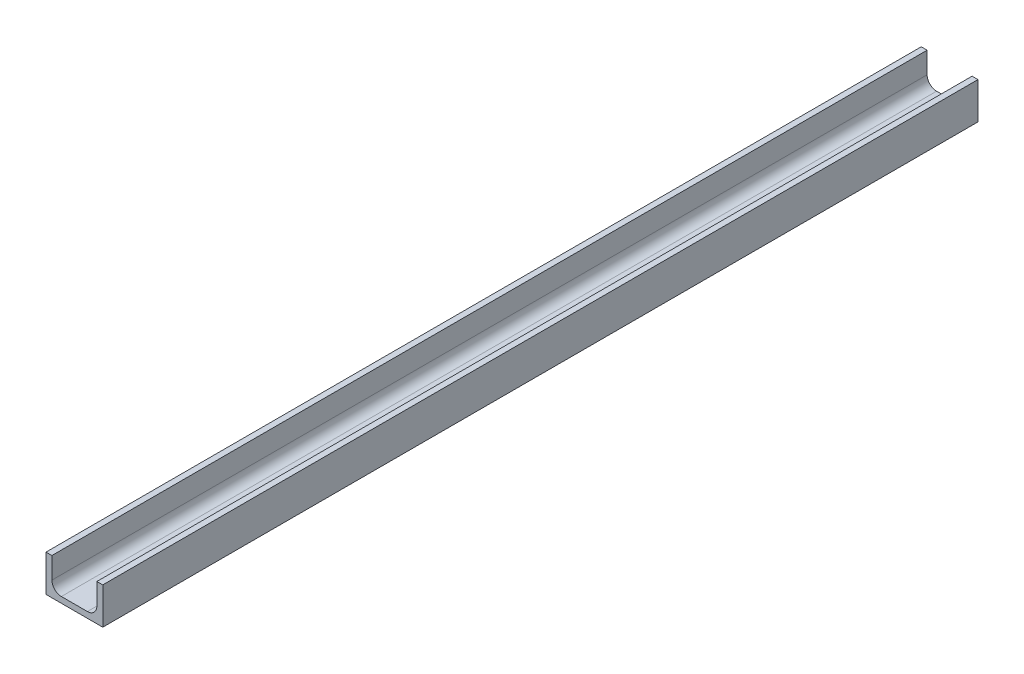
from build123d import *
from build123d.topology import SkipClean

# Parameters (mm, degrees)
BOSS_EXTRUDE1_DEPTH     = 1174.75
F_1_2_CLEARANCE_HOLE1_D = 13.09624
SKETCH116_R             = 25.146
SKETCH116_R_2           = 6.54812
BOSS_EXTRUDE2_DEPTH     = 4.953


with BuildPart() as part:
    # Sketch113 → Boss-Extrude1 (new body)
    with BuildSketch(Plane.XY):
        with BuildLine():
            Line((0, 0), (0, 49.2252))
            Line((0, 49.2252), (7.9248, 49.2252))
            Line((7.9248, 49.2252), (7.9248, 20.6248))
            ThreePointArc((7.9248, 20.6248), (11.644543879, 11.644543879), (20.6248, 7.9248))
            Line((20.6248, 7.9248), (55.5752, 7.9248))
            ThreePointArc((55.5752, 7.9248), (64.555456121, 11.644543879), (68.2752, 20.6248))
            Line((68.2752, 20.6248), (68.2752, 49.2252))
            Line((68.2752, 49.2252), (76.2, 49.2252))
            Line((76.2, 49.2252), (76.2, 0))
            Line((76.2, 0), (0, 0))
        make_face()
    extrude(amount=BOSS_EXTRUDE1_DEPTH)

    # 1/2 Clearance Hole1 (through all)
    with Locations(Plane(origin=(38.1, 0, 206.375), x_dir=(0, 0, -1), z_dir=(0, -1, 0))):
        with Locations((0, 0), (-762, 0)):
            Hole(F_1_2_CLEARANCE_HOLE1_D / 2)

    # Sketch116 → Boss-Extrude2 (add)
    # profile 1 of 2: a face of its own
    with SkipClean():  # the faces are left unmerged after this step: merging them gives an invalid solid
        with BuildSketch(Plane.XZ):
            with Locations((38.1, 968.375)):
                Circle(SKETCH116_R)
            with Locations((38.1, 968.375)):
                Circle(SKETCH116_R_2, mode=Mode.SUBTRACT)
        # profile 2 of 2: a face of its own
        with BuildSketch(Plane.XZ):
            with Locations((38.1, 206.375)):
                Circle(SKETCH116_R)
            with Locations((38.1, 206.375)):
                Circle(SKETCH116_R_2, mode=Mode.SUBTRACT)
        extrude(amount=BOSS_EXTRUDE2_DEPTH)
    add(part.part.scale(1), mode=Mode.REPLACE)  # the faces are merged on a copy


solid = part.part
